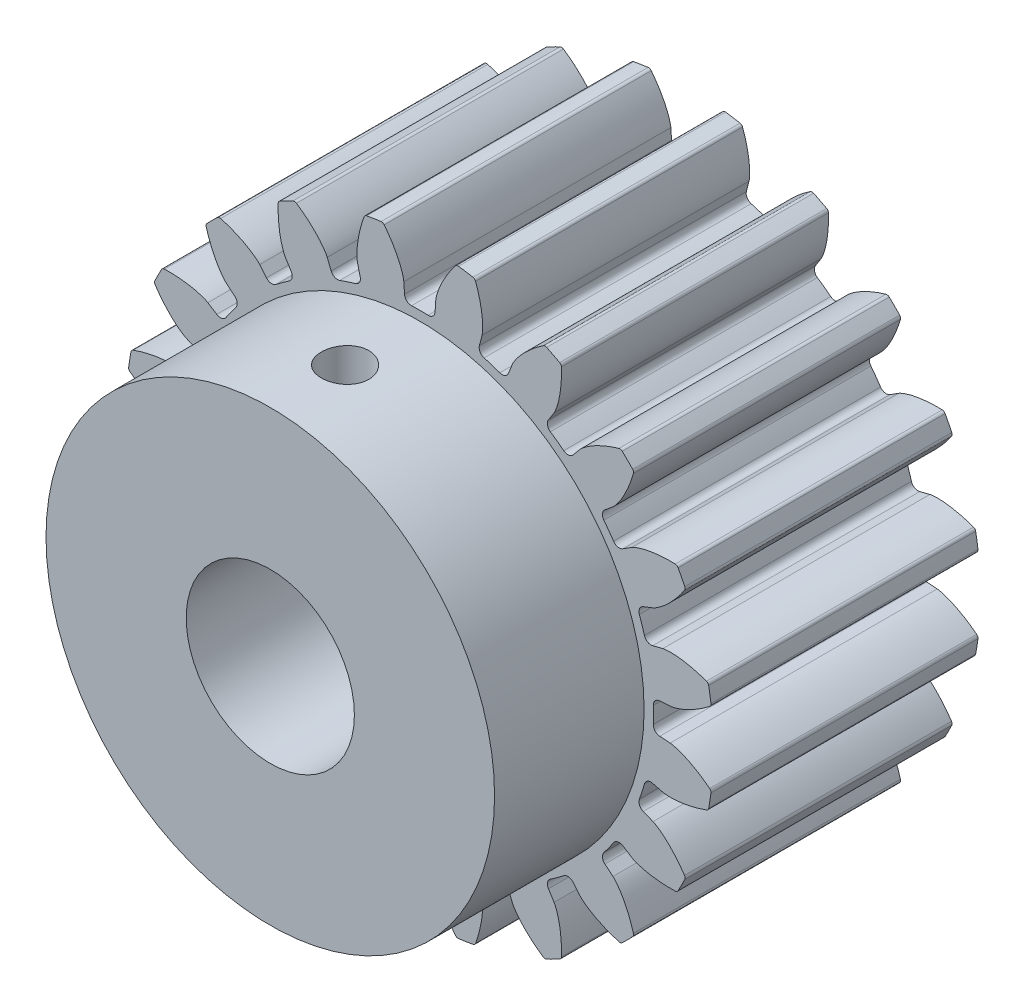
from build123d import *

# Parameters (mm, degrees)
SKETCH1_R                            = 13.97
BOSS_EXTRUDE1_DEPTH                  = 12.7
CUT_EXTRUDE_DCLTBC_DEPTH             = 24.486417351
FILLET_DCLTBC_R                      = 0.16191473
CIRPATTERN_DCLTBC_COUNT              = 20
FILLET_DCLTBC_OF_CIRPATTERN_DCLTBC_R = 0.16191473
SKETCH4_R                            = 4
CUT_EXTRUDE2_DEPTH                   = 24.343425331
BOSS_EXTRUDE3_START                  = 7.112
SKETCH7_R                            = 10.668
SKETCH7_R_2                          = 4
BOSS_EXTRUDE3_DEPTH                  = 7.112


# Read off the part's stored shape, not the designer's step: #4-40 Tapped Hole1
with BuildPart() as part:
    # Sketch1 → Boss-Extrude1 (new body)
    with BuildSketch(Plane.XY):
        Circle(SKETCH1_R)
    extrude(amount=BOSS_EXTRUDE1_DEPTH)

    # DCLTBC → Cut-Extrude-DCLTBC (cut, through all)
    with BuildSketch(Plane.XY):
        with BuildLine():
            Line((-0.758918933, 11.909941065), (-0.726973085, 11.408605355))
            ThreePointArc((-0.726973085, 11.408605355), (-0.621176478, 11.189172265), (-0.392365156, 11.105570937))
            ThreePointArc((-0.392365156, 11.105570937), (0, 11.1125), (0.392365156, 11.105570937))
            ThreePointArc((0.392365156, 11.105570937), (0.621176478, 11.189172265), (0.726973085, 11.408605355))
            Line((0.726973085, 11.408605355), (0.758918933, 11.909941065))
            add(Edge.make_bspline(
                [(0.758918933, 11.909941065), (0.75916867, 11.91319885), (0.759999028, 11.922326373), (0.762081733, 11.939541821), (0.766207532, 11.967563), (0.772532437, 12.003153475), (0.78193155, 12.049006316), (0.794575497, 12.102812796), (0.81011376, 12.161703212), (0.828787319, 12.2254893), (0.848977261, 12.288855455), (0.870566157, 12.351797854), (0.89337607, 12.414244834), (0.922542307, 12.489569754), (0.959648005, 12.579436809), (1.006111611, 12.683765988), (1.062447697, 12.80121371), (1.123732073, 12.919908456), (1.187207606, 13.035856633), (1.254962387, 13.151968715), (1.323083241, 13.263573377), (1.397516484, 13.378357846), (1.468094979, 13.483735575), (1.551203565, 13.600466468), (1.619454211, 13.694286594), (1.693297947, 13.790047056), (1.72972993, 13.836481646), (1.748555626, 13.860139004)],
                knots=[0, 0, 0, 0, 0, 0.005376749, 0.015083688, 0.02853182, 0.04661014, 0.064854849, 0.092110526, 0.119476176, 0.146842496, 0.174208854, 0.201574956, 0.228941013, 0.256307345, 0.307035032, 0.361767352, 0.416499661, 0.471231937, 0.525964282, 0.580696616, 0.635428982, 0.690161387, 0.744893688, 0.799626082, 0.854358407, 0.909090915, 0.909090915, 0.909090915, 0.909090915, 0.909090915], degree=4))
            ThreePointArc((1.748555626, 13.860139004), (0, 13.97), (-1.748555626, 13.860139004))
            add(Edge.make_bspline(
                [(-0.758918933, 11.909941065), (-0.75916867, 11.91319885), (-0.759999028, 11.922326373), (-0.762081733, 11.939541821), (-0.766207532, 11.967563), (-0.772532437, 12.003153475), (-0.78193155, 12.049006316), (-0.794575497, 12.102812796), (-0.81011376, 12.161703212), (-0.828787319, 12.2254893), (-0.848977261, 12.288855455), (-0.870566157, 12.351797854), (-0.89337607, 12.414244834), (-0.922542307, 12.489569754), (-0.959648005, 12.579436809), (-1.006111611, 12.683765988), (-1.062447697, 12.80121371), (-1.123732073, 12.919908456), (-1.187207606, 13.035856633), (-1.254962387, 13.151968715), (-1.323083241, 13.263573377), (-1.397516484, 13.378357846), (-1.468094979, 13.483735575), (-1.551203565, 13.600466468), (-1.619454211, 13.694286594), (-1.693297947, 13.790047056), (-1.72972993, 13.836481646), (-1.748555626, 13.860139004)],
                knots=[0, 0, 0, 0, 0, 0.005376749, 0.015083688, 0.02853182, 0.04661014, 0.064854849, 0.092110526, 0.119476176, 0.146842496, 0.174208854, 0.201574956, 0.228941013, 0.256307345, 0.307035032, 0.361767352, 0.416499661, 0.471231937, 0.525964282, 0.580696616, 0.635428982, 0.690161387, 0.744893688, 0.799626082, 0.854358407, 0.909090915, 0.909090915, 0.909090915, 0.909090915, 0.909090915], degree=4))
        make_face()
    cut_extrude_dcltbc = extrude(amount=CUT_EXTRUDE_DCLTBC_DEPTH, mode=Mode.SUBTRACT)

    # Fillet-DCLTBC
    fillet_dcltbc_edges = [part.edges().sort_by_distance(p)[0] for p in [
        (1.748555626, 13.860139004, 6.35),
        (-1.748555626, 13.860139004, 6.35),
    ]]
    fillet(fillet_dcltbc_edges, radius=FILLET_DCLTBC_R)

    # CirPattern-DCLTBC: Cut-Extrude-DCLTBC ×20 about axis
    cirpattern_dcltbc_axis = Axis((0, 0, 12.7), (0, 0, 1))
    for i in range(1, CIRPATTERN_DCLTBC_COUNT):
        add(cut_extrude_dcltbc.rotate(cirpattern_dcltbc_axis, i * 360 / CIRPATTERN_DCLTBC_COUNT), mode=Mode.SUBTRACT)

    # Fillet-DCLTBC of CirPattern-DCLTBC
    fillet_dcltbc_of_cirpattern_dcltbc_edges = [part.edges().sort_by_distance(p)[0] for p in [
        (-2.620043275, 13.722108921, 6.35),
        (-5.945993719, 12.641442113, 6.35),
        (-6.732174085, 12.240863209, 6.35),
        (-9.561396519, 10.185312789, 6.35),
        (-10.185312789, 9.561396519, 6.35),
        (-12.240863209, 6.732174085, 6.35),
        (-12.641442113, 5.945993719, 6.35),
        (-13.722108921, 2.620043275, 6.35),
        (-13.860139004, 1.748555626, 6.35),
        (-13.860139004, -1.748555626, 6.35),
        (-13.722108921, -2.620043275, 6.35),
        (-12.641442113, -5.945993719, 6.35),
        (-12.240863209, -6.732174085, 6.35),
        (-10.185312789, -9.561396519, 6.35),
        (-9.561396519, -10.185312789, 6.35),
        (-6.732174085, -12.240863209, 6.35),
        (-5.945993719, -12.641442113, 6.35),
        (-2.620043275, -13.722108921, 6.35),
        (-1.748555626, -13.860139004, 6.35),
        (1.748555626, -13.860139004, 6.35),
        (2.620043275, -13.722108921, 6.35),
        (5.945993719, -12.641442113, 6.35),
        (6.732174085, -12.240863209, 6.35),
        (9.561396519, -10.185312789, 6.35),
        (10.185312789, -9.561396519, 6.35),
        (12.240863209, -6.732174085, 6.35),
        (12.641442113, -5.945993719, 6.35),
        (13.722108921, -2.620043275, 6.35),
        (13.860139004, -1.748555626, 6.35),
        (13.860139004, 1.748555626, 6.35),
        (13.722108921, 2.620043275, 6.35),
        (12.641442113, 5.945993719, 6.35),
        (12.240863209, 6.732174085, 6.35),
        (10.185312789, 9.561396519, 6.35),
        (9.561396519, 10.185312789, 6.35),
        (6.732174085, 12.240863209, 6.35),
        (5.945993719, 12.641442113, 6.35),
        (2.620043275, 13.722108921, 6.35),
    ]]
    fillet(fillet_dcltbc_of_cirpattern_dcltbc_edges, radius=FILLET_DCLTBC_OF_CIRPATTERN_DCLTBC_R)

    # Sketch4 → Cut-Extrude2 (cut, through all)
    with BuildSketch(Plane.XY.offset(12.7)):
        Circle(SKETCH4_R)
    extrude(amount=-CUT_EXTRUDE2_DEPTH, mode=Mode.SUBTRACT)

    # Sketch7 → Boss-Extrude3 (add)
    with BuildSketch(Plane.XY.offset(12.7).offset(BOSS_EXTRUDE3_START)):
        Circle(SKETCH7_R)
        Circle(SKETCH7_R_2, mode=Mode.SUBTRACT)
    extrude(amount=-BOSS_EXTRUDE3_DEPTH)

    # #4-40 Tapped Hole1 outline → #4-40 Tapped Hole1 (revolve, cut)
    with BuildSketch(Plane.XY.offset(16.256)):
        Polygon((0.942688262, 3.887271495), (1.1303, 4), (1.1303, 10.668032321), (0, 10.668032321), (0, 3.887271495), align=None)
    revolve(axis=Axis((0, 0, 16.256), (0, 1, 0)), mode=Mode.SUBTRACT)


solid = part.part
